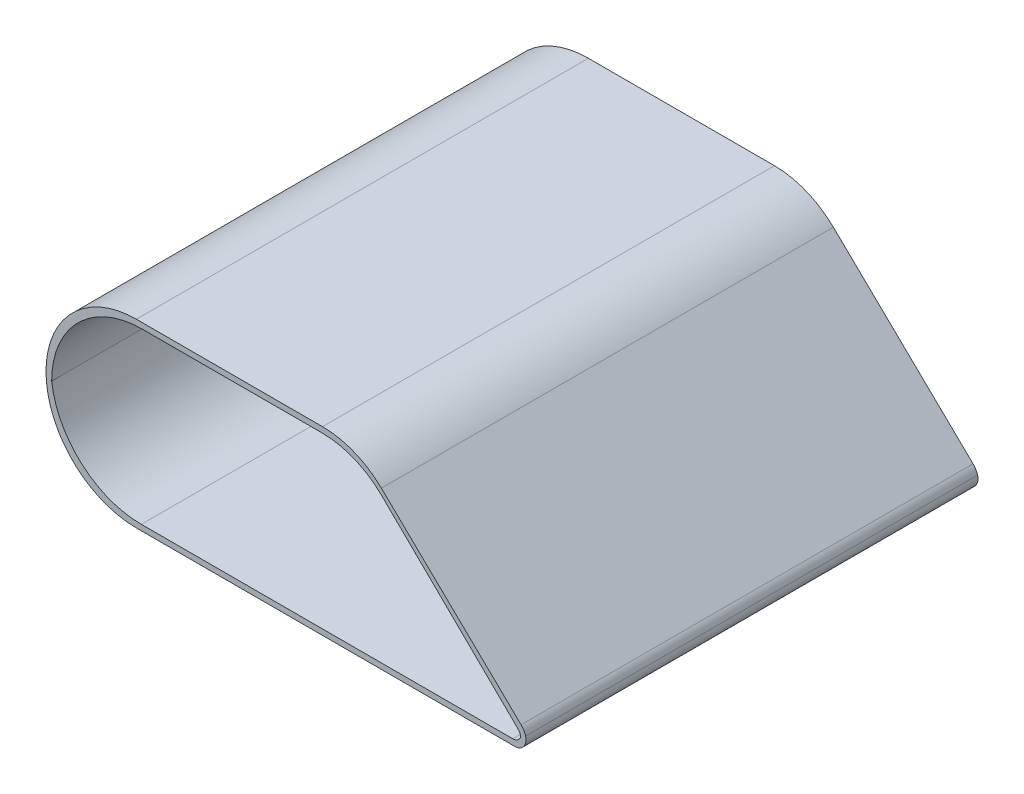
from build123d import *

# Parameters (mm, degrees)
SKETCH1_W               = 85
SKETCH1_H               = 32
BOSS_EXTRUDE1_DEPTH     = 80
CUT_EXTRUDE7_DEPTH      = 122.033053337
CUT_EXTRUDE7_DEPTH_BACK = 80
CUT_EXTRUDE8_DEPTH      = 79
FILLET11_R              = 16
FILLET12_R              = 16
FILLET13_R              = 16
FILLET14_R              = 16
FILLET15_R              = 15
FILLET16_R              = 15
FILLET17_R              = 1.5
FILLET18_R              = 1.5
FILLET21_R              = 3
FILLET22_R              = 2
SKETCH18_W              = 15
SKETCH18_H              = 5
CUT_EXTRUDE14_DEPTH     = 79
SKETCH17_W              = 10
SKETCH17_H              = 5
CUT_EXTRUDE15_DEPTH     = 79
SKETCH16_W              = 10
SKETCH16_H              = 5
CUT_EXTRUDE16_DEPTH     = 79
FILLET29_R              = 2.5
FILLET30_R              = 2.5
FILLET31_R              = 2.5
FILLET32_R              = 2.5
FILLET33_R              = 2.5
FILLET34_R              = 2.5
FILLET35_R              = 2.5
FILLET36_R              = 2.5
FILLET37_R              = 2.5


# Some blends are built 0.0001 mm under size
with BuildPart() as part:
    # Sketch1 → Boss-Extrude1 (new body)
    with BuildSketch(Plane.XY):
        with Locations((42.5, 16)):
            Rectangle(SKETCH1_W, SKETCH1_H)
    extrude(amount=BOSS_EXTRUDE1_DEPTH)

    # Sketch3 → Cut-Extrude7 (cut, two sides: drawn at the far end of the back side and taken through both)
    with BuildSketch(Plane.XY.offset(80).offset(-CUT_EXTRUDE7_DEPTH_BACK)):
        Polygon((221.335887988, -128.791358388), (85, 3), (55, 32), (-81.335887988, 163.791358388), (182.246828788, 436.463134363), (484.918604763, 143.880417587), align=None)
    extrude(amount=CUT_EXTRUDE7_DEPTH + CUT_EXTRUDE7_DEPTH_BACK, mode=Mode.SUBTRACT)

    # Sketch6 → Cut-Extrude8 (cut)
    with BuildSketch(Plane.XY.offset(80)):
        Polygon((1, 31), (1, 1), (84, 1), (84, 2.535105728), (55, 31), align=None)
    extrude(amount=-CUT_EXTRUDE8_DEPTH, mode=Mode.SUBTRACT)

    # Fillet11
    fillet11_edges = [part.edges().sort_by_distance(p)[0] for p in [
        (1, 31, 40.5),
    ]]
    fillet(fillet11_edges, radius=FILLET11_R)

    # Fillet12
    # the kernel refuses this fillet: 16 mm, written as the material it adds along each edge
    with BuildSketch(Plane(origin=(1, 1, 80), x_dir=(0, 1, 0), z_dir=(0, 0, -1))) as fillet12_piece_1:
        with BuildLine():
            CenterArc((16, 15.874507866), FILLET12_R, 180, 82.819244219)
            Line((0, 15.874507866), (-0.32, 15.874507866))
            Line((-0.32, 15.874507866), (-0.32, 0))
            Line((-0.32, 0), (0, -0.32))
            ThreePointArc((0, -0.32), (7, -0.32), (13.96, -0.317490157))
            Line((13.96, -0.317490157), (14, 0))
        make_face()
    extrude(amount=79)

    # Fillet13
    fillet13_edges = [part.edges().sort_by_distance(p)[0] for p in [
        (0, 32, 40),
    ]]
    fillet(fillet13_edges, radius=FILLET13_R)

    # Fillet14
    fillet14_edges = [part.edges().sort_by_distance(p)[0] for p in [
        (0, 0, 40),
    ]]
    fillet(fillet14_edges, radius=FILLET14_R - 0.0001)  # a hair under: the kernel refuses the full size

    # Fillet15
    fillet15_edges = [part.edges().sort_by_distance(p)[0] for p in [
        (55, 31, 40.5),
    ]]
    fillet(fillet15_edges, radius=FILLET15_R)

    # Fillet16
    fillet16_edges = [part.edges().sort_by_distance(p)[0] for p in [
        (55, 32, 40),
    ]]
    fillet(fillet16_edges, radius=FILLET16_R)

    # Fillet17
    fillet17_edges = [part.edges().sort_by_distance(p)[0] for p in [
        (84, 2.535105728, 40.5),
    ]]
    fillet(fillet17_edges, radius=FILLET17_R)

    # Fillet18
    # the kernel refuses this fillet: 1.5 mm, written as the material it adds along each edge
    with BuildSketch(Plane(origin=(84, 1, 80), x_dir=(0, 1, 0), z_dir=(0, 0, -1))) as fillet18_piece_1:
        with BuildLine():
            CenterArc((1.5, -1.377197843), FILLET18_R, 113.345512124, 66.654487876)
            Line((0, -1.377197843), (-0.03, -1.377197843))
            Line((-0.03, -1.377197843), (-0.03, 0))
            Line((-0.03, 0), (0, 0.03))
            ThreePointArc((0, 0.03), (0.4527938, 0.03), (0.893699352, 0.027543957))
            Line((0.893699352, 0.027543957), (0.9055876, 0))
        make_face()
    extrude(amount=79)

    # Fillet21
    fillet21_edges = [part.edges().sort_by_distance(p)[0] for p in [
        (85, 3, 40),
    ]]
    fillet(fillet21_edges, radius=FILLET21_R)

    # Fillet22
    fillet22_edges = [part.edges().sort_by_distance(p)[0] for p in [
        (85, 0, 40),
    ]]
    fillet(fillet22_edges, radius=FILLET22_R)

    # Sketch18 → Cut-Extrude14 (cut)
    with BuildSketch(Plane(origin=(0, 0, 0), x_dir=(-1, 0, 0), z_dir=(0, 0, -1))):
        with Locations((-39.386442529, 20)):
            Rectangle(SKETCH18_W, SKETCH18_H)
    extrude(amount=-CUT_EXTRUDE14_DEPTH, mode=Mode.SUBTRACT)

    # Sketch17 → Cut-Extrude15 (cut)
    with BuildSketch(Plane(origin=(0, 0, 0), x_dir=(-1, 0, 0), z_dir=(0, 0, -1))):
        with Locations((-33.386442529, 10)):
            Rectangle(SKETCH17_W, SKETCH17_H)
    extrude(amount=-CUT_EXTRUDE15_DEPTH, mode=Mode.SUBTRACT)

    # Sketch16 → Cut-Extrude16 (cut)
    with BuildSketch(Plane(origin=(0, 0, 0), x_dir=(-1, 0, 0), z_dir=(0, 0, -1))):
        with Locations((-26.886442529, 3.5)):
            Rectangle(SKETCH16_W, SKETCH16_H)
    extrude(amount=-CUT_EXTRUDE16_DEPTH, mode=Mode.SUBTRACT)

    # Fillet29
    fillet29_edges = [part.edges().sort_by_distance(p)[0] for p in [
        (31.886442529, 22.5, 0.5),
    ]]
    fillet(fillet29_edges, radius=FILLET29_R)

    # Fillet30
    fillet30_edges = [part.edges().sort_by_distance(p)[0] for p in [
        (31.886442529, 17.5, 0.5),
    ]]
    fillet(fillet30_edges, radius=FILLET30_R - 0.0001)  # a hair under: the kernel refuses the full size

    # Fillet31
    fillet31_edges = [part.edges().sort_by_distance(p)[0] for p in [
        (46.886442529, 22.5, 0.5),
    ]]
    fillet(fillet31_edges, radius=FILLET31_R)

    # Fillet32
    fillet32_edges = [part.edges().sort_by_distance(p)[0] for p in [
        (28.386442529, 12.5, 0.5),
    ]]
    fillet(fillet32_edges, radius=FILLET32_R)

    # Fillet33
    fillet33_edges = [part.edges().sort_by_distance(p)[0] for p in [
        (28.386442529, 7.5, 0.5),
    ]]
    fillet(fillet33_edges, radius=FILLET33_R - 0.0001)  # a hair under: the kernel refuses the full size

    # Fillet34
    fillet34_edges = [part.edges().sort_by_distance(p)[0] for p in [
        (38.386442529, 12.5, 0.5),
    ]]
    fillet(fillet34_edges, radius=FILLET34_R)

    # Fillet35
    fillet35_edges = [part.edges().sort_by_distance(p)[0] for p in [
        (21.886442529, 6, 0.5),
    ]]
    fillet(fillet35_edges, radius=FILLET35_R)

    # Fillet36
    fillet36_edges = [part.edges().sort_by_distance(p)[0] for p in [
        (21.886442529, 1, 0.5),
    ]]
    fillet(fillet36_edges, radius=FILLET36_R - 0.0001)  # a hair under: the kernel refuses the full size

    # Fillet37
    fillet37_edges = [part.edges().sort_by_distance(p)[0] for p in [
        (31.886442529, 6, 0.5),
    ]]
    fillet(fillet37_edges, radius=FILLET37_R)


solid = part.part
